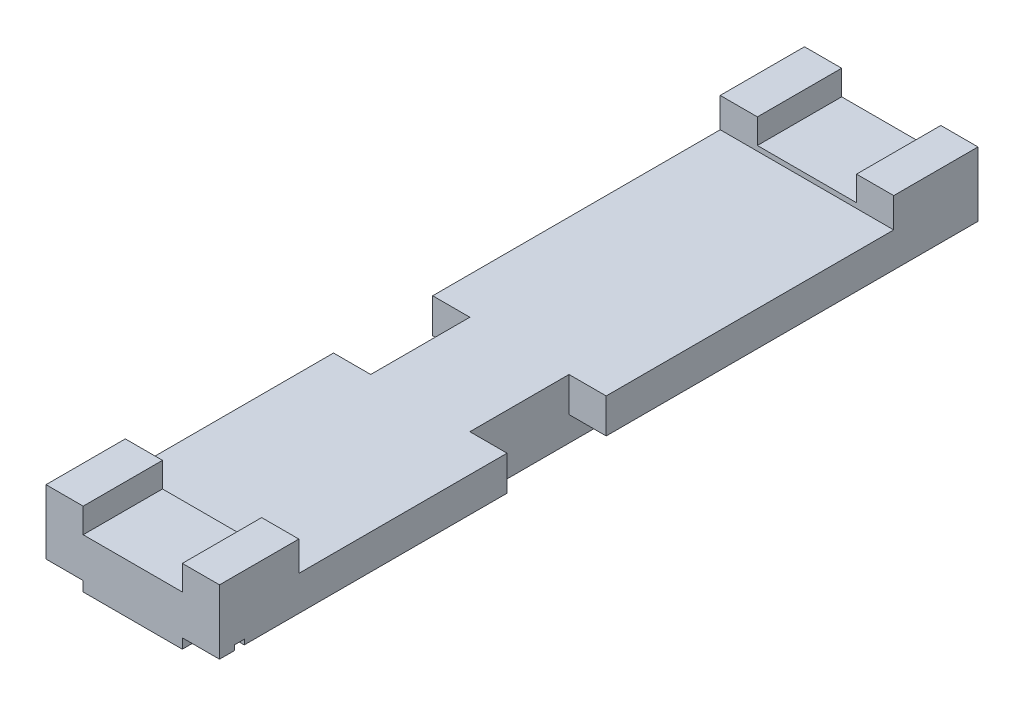
from build123d import *

# Parameters (mm, degrees)
SKETCH2_W           = 3.5
SKETCH2_H           = 15.3
BOSS_EXTRUDE1_DEPTH = 1.8
SKETCH3_W           = 12
SKETCH3_H           = 0.6
CUT_EXTRUDE1_DEPTH  = 16.798101152
SKETCH4_W           = 2.3
SKETCH4_H           = 0.3
CUT_EXTRUDE2_DEPTH  = 16.798101152
SKETCH5_W           = 0.75
SKETCH5_H           = 2
CUT_EXTRUDE3_DEPTH  = 16.446439719
SKETCH8_W           = 2
SKETCH8_H           = 0.5
CUT_EXTRUDE5_DEPTH  = 16.504596093
SKETCH9_W           = 0.75
SKETCH9_H           = 0.5
CUT_EXTRUDE6_DEPTH  = 16.504596093
SKETCH10_W          = 0.2
SKETCH10_H          = 0.3
CUT_EXTRUDE7_DEPTH  = 16.798101152


with BuildPart() as part:
    # Sketch2 → Boss-Extrude1 (new body)
    with BuildSketch(Plane(origin=(0, 0, 0), x_dir=(1, 0, 0), z_dir=(0, 1, 0))):
        with Locations((0, 7.65)):
            Rectangle(SKETCH2_W, SKETCH2_H)
    extrude(amount=BOSS_EXTRUDE1_DEPTH)

    # Sketch3 → Cut-Extrude1 (cut, through all)
    with BuildSketch(Plane(origin=(1.75, 0, 0), x_dir=(0, 0, -1), z_dir=(1, 0, 0))):
        with Locations((7.6, 1.5)):
            Rectangle(SKETCH3_W, SKETCH3_H)
    extrude(amount=-CUT_EXTRUDE1_DEPTH, mode=Mode.SUBTRACT)

    # Sketch4 → Cut-Extrude2 (cut, through all)
    with BuildSketch(Plane(origin=(1.75, 0, 0), x_dir=(0, 0, -1), z_dir=(1, 0, 0))):
        with Locations((1.15, 0.15)):
            Rectangle(SKETCH4_W, SKETCH4_H)
        with Locations((14.15, 0.15)):
            Rectangle(SKETCH4_W, SKETCH4_H)
    extrude(amount=-CUT_EXTRUDE2_DEPTH, mode=Mode.SUBTRACT)

    # Sketch5 → Cut-Extrude3 (cut, through all)
    with BuildSketch(Plane(origin=(0, 1.2, 0), x_dir=(1, 0, 0), z_dir=(0, 1, 0))):
        with Locations((-1.375, 6.8)):
            Rectangle(SKETCH5_W, SKETCH5_H)
        with Locations((1.375, 6.8)):
            Rectangle(SKETCH5_W, SKETCH5_H)
    extrude(amount=-CUT_EXTRUDE3_DEPTH, mode=Mode.SUBTRACT)

    # Sketch8 → Cut-Extrude5 (cut, through all)
    with BuildSketch(Plane.XY):
        with Locations((0, 1.55)):
            Rectangle(SKETCH8_W, SKETCH8_H)
    extrude(amount=-CUT_EXTRUDE5_DEPTH, mode=Mode.SUBTRACT)

    # Sketch9 → Cut-Extrude6 (cut, through all)
    with BuildSketch(Plane.XY):
        with Locations((-1.375, 0.25)):
            Rectangle(SKETCH9_W, SKETCH9_H)
        with Locations((1.375, 0.25)):
            Rectangle(SKETCH9_W, SKETCH9_H)
    extrude(amount=-CUT_EXTRUDE6_DEPTH, mode=Mode.SUBTRACT)

    # Sketch10 → Cut-Extrude7 (cut, through all)
    with BuildSketch(Plane(origin=(1.75, 0, 0), x_dir=(0, 0, -1), z_dir=(1, 0, 0))):
        with Locations((0.4, 0.45)):
            Rectangle(SKETCH10_W, SKETCH10_H)
    extrude(amount=-CUT_EXTRUDE7_DEPTH, mode=Mode.SUBTRACT)


solid = part.part
